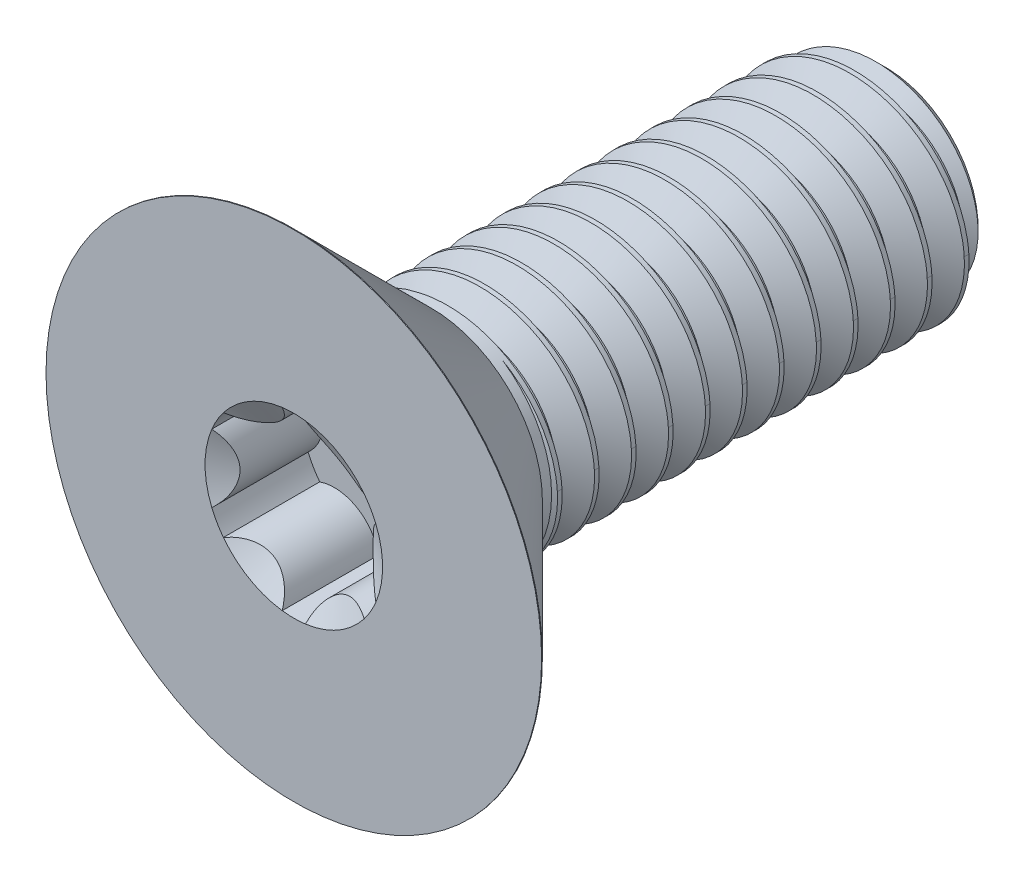
from build123d import *

# Parameters (mm, degrees)
CHAMFER1_SIZE      = 0.25
CUT_EXTRUDE2_DEPTH = 1.302
CIRPATTERN1_COUNT  = 6
CUT_SWEEP2_PITCH   = 0.5


with BuildPart() as part:
    # Sketch12 → Revolve3 (revolve)
    with BuildSketch(Plane(origin=(0, 0, 0), x_dir=(0, 0, -1), z_dir=(1, 0, 0)), mode=Mode.PRIVATE) as revolve3_sk:
        Polygon((0, 0), (8, 0), (8, 1.5), (1.86, 1.5), (0.01, 3.35), (0, 3.35), align=None)
    revolve(revolve3_sk.sketch.rotate(Axis((0, 0, 0), (0, 0, -1)), 90), axis=Axis((0, 0, 0), (0, 0, -1)))

    # Chamfer1
    chamfer1_edges = [part.edges().sort_by_distance(p)[0] for p in [
        (-1.5, 0, -8),
    ]]
    chamfer(chamfer1_edges, length=CHAMFER1_SIZE)

    # Sketch5 → Cut-Extrude2 (cut)
    with BuildSketch(Plane.XY):
        with BuildLine():
            Line((-1.039230485, -0.6), (0, 0))
            Line((0, 0), (-1.039230485, 0.6))
            ThreePointArc((-1.039230485, 0.6), (-1.07624729, 0.530746428), (-1.108655439, 0.459220119))
            ThreePointArc((-1.108655439, 0.459220119), (-0.9, 0), (-1.108655439, -0.459220119))
            ThreePointArc((-1.108655439, -0.459220119), (-1.07624729, -0.530746428), (-1.039230485, -0.6))
        make_face()
    cut_extrude2 = extrude(amount=-CUT_EXTRUDE2_DEPTH, mode=Mode.SUBTRACT)

    # CirPattern1: Cut-Extrude2 ×6 about axis
    cirpattern1_axis = Axis((0, 0, 0), (0, 0, 1))
    for i in range(1, CIRPATTERN1_COUNT):
        add(cut_extrude2.rotate(cirpattern1_axis, i * 360 / CIRPATTERN1_COUNT), mode=Mode.SUBTRACT)

    # Cut-Extrude3 cone 1 section (through the dimple's axis) → Cut-Extrude3 (revolve, cut)
    with BuildSketch(Plane(origin=(0, 0, 0), x_dir=(0, -1, 0), z_dir=(1, 0, 0))):
        Polygon((0, 0), (1.2, 0), (0, 0.692820323), align=None)
    revolve(axis=Axis((0, 0, 0), (0, 0, -1)), mode=Mode.SUBTRACT)


with BuildPart() as body_2:
    # Split1: the piece on the far side of the plane
    add(part.part)
    split(bisect_by=Plane.XY.offset(-1.86), keep=Keep.BOTTOM)

    # Cut-Sweep2: the profile of Sketch14 screwed along a right-hand helix of 13.508 turns, 6 arcs to a turn; built about Z, then put on its axis
    cut_sweep2_z = Axis((0, 0, 0), (0, 0, 1))
    cut_sweep2_corners = [(1.175240474, 0, -0.1875), (1.175240474, 0, -0.25), (1.527063294, 0, -0.453125), (1.527063294, 0, 0.015625)]
    with BuildLine(mode=Mode.PRIVATE) as cut_sweep2_profile:
        Line(cut_sweep2_corners[0], cut_sweep2_corners[1])
        Line(cut_sweep2_corners[1], cut_sweep2_corners[2])
        Line(cut_sweep2_corners[2], cut_sweep2_corners[3])
        Line(cut_sweep2_corners[3], cut_sweep2_corners[0])
    cut_sweep2_cap = Face(cut_sweep2_profile.wire())
    cut_sweep2_turn_angles = [0, 30, 60, 90, 120, 150, 180, 210, 240, 270, 300, 330, 360]
    cut_sweep2_turn_weights = [1, 0.8660254037844387, 1, 0.8660254037844387, 1, 0.8660254037844387, 1, 0.8660254037844387, 1, 0.8660254037844387, 1, 0.8660254037844387, 1]
    cut_sweep2_turn_rails = [Edge.make_bspline([Vector(p[0], p[1], 0).rotate(cut_sweep2_z, cut_sweep2_turn_angles[k]) / cut_sweep2_turn_weights[k] + Vector(0, 0, p[2] + CUT_SWEEP2_PITCH * cut_sweep2_turn_angles[k] / 360) for k in range(13)], [0, 0, 0, 1, 1, 2, 2, 3, 3, 4, 4, 5, 5, 6, 6, 6], 2, cut_sweep2_turn_weights) for p in cut_sweep2_corners]
    cut_sweep2_turn_sides = [Face.make_surface_from_curves(cut_sweep2_turn_rails[p[0]], cut_sweep2_turn_rails[p[1]]) for p in [(0, 1), (1, 2), (2, 3), (3, 0)]]
    cut_sweep2_last_angles = [4680, 4710, 4740, 4770, 4800, 4830, 4860, 4861.44, 4862.88]
    cut_sweep2_last_weights = [1, 0.8660254037844387, 1, 0.8660254037844387, 1, 0.8660254037844387, 1, 0.9996841892832934, 1]
    cut_sweep2_last_rails = [Edge.make_bspline([Vector(p[0], p[1], 0).rotate(cut_sweep2_z, cut_sweep2_last_angles[k]) / cut_sweep2_last_weights[k] + Vector(0, 0, p[2] + CUT_SWEEP2_PITCH * cut_sweep2_last_angles[k] / 360) for k in range(9)], [0, 0, 0, 1, 1, 2, 2, 3, 3, 4, 4, 4], 2, cut_sweep2_last_weights) for p in cut_sweep2_corners]
    cut_sweep2_last_sides = [Face.make_surface_from_curves(cut_sweep2_last_rails[p[0]], cut_sweep2_last_rails[p[1]]) for p in [(0, 1), (1, 2), (2, 3), (3, 0)]]
    cut_sweep2 = Plane(origin=(0, 0, -8), x_dir=(0, 1, 0), z_dir=(0, 0, 1)) * Solid(Shell([*[p.moved(Location((0, 0, CUT_SWEEP2_PITCH * i))) for i in range(13) for p in cut_sweep2_turn_sides], *cut_sweep2_last_sides, cut_sweep2_cap, cut_sweep2_cap.rotate(cut_sweep2_z, 4862.88).moved(Location((0, 0, CUT_SWEEP2_PITCH * 4862.88 / 360)))]))
    add(cut_sweep2, mode=Mode.SUBTRACT)


with BuildPart() as part_1:
    add(part.part)

    # Split1
    split(bisect_by=Plane.XY.offset(-1.86), keep=Keep.TOP)

    add(body_2.part)  # Revolve4 merges body 2
    # Sketch15 → Revolve4 (revolve)
    with BuildSketch(Plane(origin=(0, 0, 0), x_dir=(0, 0, -1), z_dir=(1, 0, 0)), mode=Mode.PRIVATE) as revolve4_sk:
        Polygon((1.86, 1.5), (1.985, 1.5), (2.851025404, 0), (1.86, 0), align=None)
    revolve(revolve4_sk.sketch.rotate(Axis((0, 0, 0), (0, 0, -1)), 90), axis=Axis((0, 0, 0), (0, 0, -1)))


solid = part_1.part
